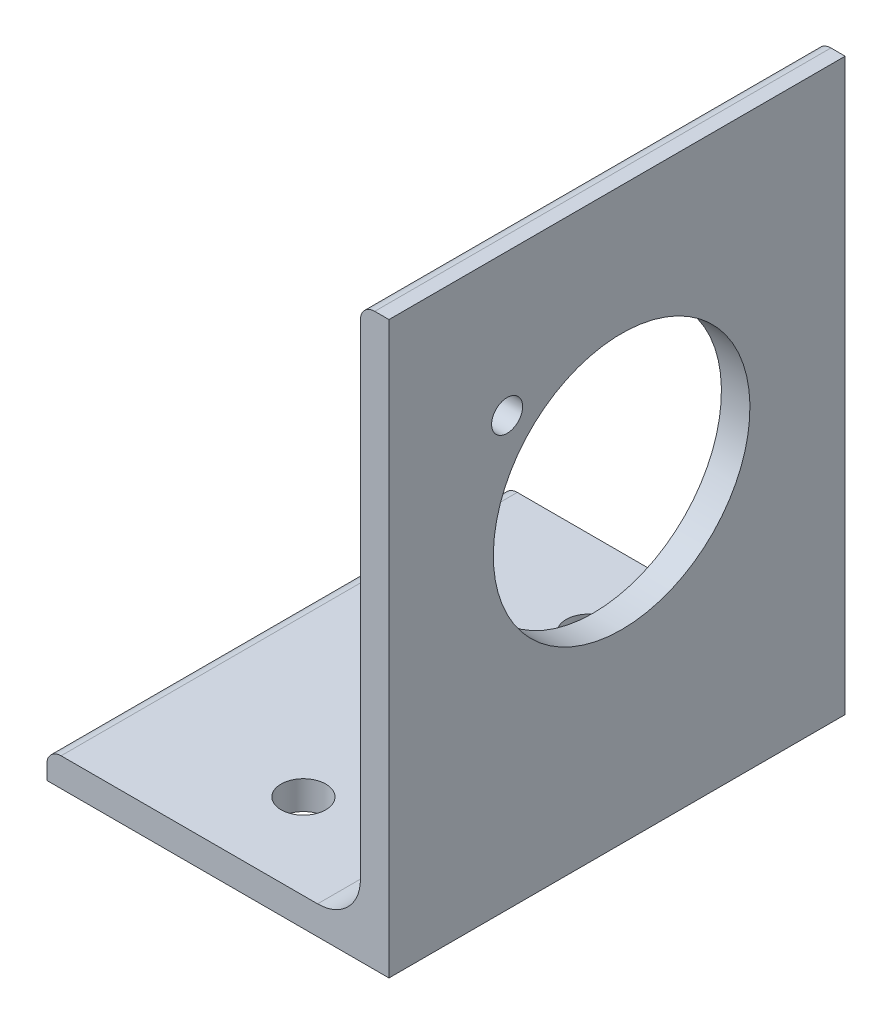
from build123d import *

# Parameters (mm, degrees)
BOSS_EXTRUDE1_DEPTH = 25.4
SKETCH3_R           = 14.2875
SKETCH3_R_2         = 1.7272
CUT_EXTRUDE1_DEPTH  = 54.600169076
SKETCH9_R           = 2.4892
CUT_EXTRUDE2_DEPTH  = 71.995158286


with BuildPart() as part:
    # Sketch2 → Boss-Extrude1 (new, symmetric)
    with BuildSketch(Plane.XY):
        with BuildLine():
            Line((-19.05, -31.75), (19.05, -31.75))
            Line((19.05, -31.75), (19.05, 31.75))
            Line((19.05, 31.75), (17.4625, 31.75))
            ThreePointArc((17.4625, 31.75), (16.339967985, 31.285032015), (15.875, 30.1625))
            Line((15.875, 30.1625), (15.875, -23.7998))
            ThreePointArc((15.875, -23.7998), (14.476376302, -27.176376302), (11.0998, -28.575))
            Line((11.0998, -28.575), (-17.4625, -28.575))
            ThreePointArc((-17.4625, -28.575), (-18.585032015, -29.039967985), (-19.05, -30.1625))
            Line((-19.05, -30.1625), (-19.05, -31.75))
        make_face()
    extrude(amount=BOSS_EXTRUDE1_DEPTH, both=True)

    # Sketch3 → Cut-Extrude1 (cut, through all)
    with BuildSketch(Plane.ZY.offset(-15.875)):
        with Locations((-0.50799991, 3.175)):
            Circle(SKETCH3_R)
        with Locations((12.243963782, 15.926963692)):
            Circle(SKETCH3_R_2)
    extrude(amount=-CUT_EXTRUDE1_DEPTH, mode=Mode.SUBTRACT)

    # Sketch9 → Cut-Extrude2 (cut, through all)
    with BuildSketch(Plane.XZ.offset(31.75)):
        with Locations((0, 15.875)):
            Circle(SKETCH9_R)
        with Locations((0, -15.875)):
            Circle(SKETCH9_R)
    extrude(amount=-CUT_EXTRUDE2_DEPTH, mode=Mode.SUBTRACT)


solid = part.part
